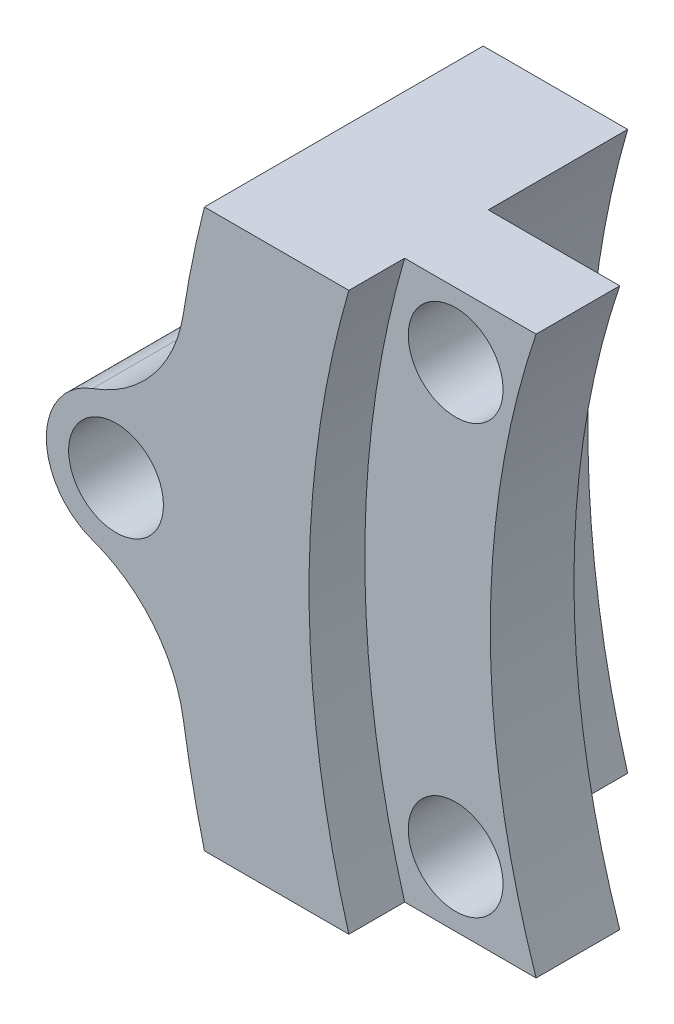
from build123d import *

# Parameters (mm, degrees)
CROQUIS1_R                       = 40.75
CROQUIS1_R_2                     = 35.75
SALIENTE_EXTRUIR1_DEPTH          = 10
CROQUIS2_R                       = 1.7
SALIENTE_EXTRUIR2_DEPTH          = 3
SALIENTE_EXTRUIR3_START          = -5
CROQUIS3_R                       = 1.7
SALIENTE_EXTRUIR3_DEPTH          = 5
CORTAR_EXTRUIR1_DEPTH            = 10
REDONDEO1_R                      = 5
TALADRO_DE_MARGEN_PARA_M51_DEPTH = 5


# Read off the part's stored shape, not the designer's step: Taladro de margen para M51
with BuildPart() as part:
    # Croquis1 → Saliente-Extruir1 (new body)
    with BuildSketch(Plane.XY):
        Circle(CROQUIS1_R)
        Circle(CROQUIS1_R_2, mode=Mode.SUBTRACT)
    extrude(amount=SALIENTE_EXTRUIR1_DEPTH)

    # Croquis2 → Saliente-Extruir2 (add)
    with BuildSketch(Plane(origin=(0, 0, 5), x_dir=(-1, 0, 0), z_dir=(0, 0, -1))):
        with BuildLine():
            Line((34.322915086, -10), (29.606798206, -10))
            ThreePointArc((29.606798206, -10), (31.25, 0), (29.606798206, 10))
            Line((29.606798206, 10), (34.322915086, 10))
            ThreePointArc((34.322915086, 10), (35.75, 0), (34.322915086, -10))
        make_face()
        with Locations((32.492418426, 7.677165354)):
            Circle(CROQUIS2_R, mode=Mode.SUBTRACT)
        with Locations(Location((32.492418426, -7.677165354, 0), (0, 0, 180))):
            Circle(CROQUIS2_R, mode=Mode.SUBTRACT)
    extrude(amount=-SALIENTE_EXTRUIR2_DEPTH)

    # Croquis3 → Saliente-Extruir3 (add)
    with BuildSketch(Plane.XY.offset(10).offset(SALIENTE_EXTRUIR3_START)):
        with BuildLine():
            Line((-40.673240589, -2.5), (-42.673240589, -2.5))
            ThreePointArc((-42.673240589, -2.5), (-45.173240589, 0), (-42.673240589, 2.5))
            Line((-42.673240589, 2.5), (-40.673240589, 2.5))
            ThreePointArc((-40.673240589, 2.5), (-40.75, 0), (-40.673240589, -2.5))
        make_face()
        with Locations((-42.673240589, 0)):
            Circle(CROQUIS3_R, mode=Mode.SUBTRACT)
    extrude(amount=SALIENTE_EXTRUIR3_DEPTH)

    # Croquis4 → Cortar-Extruir1 (cut)
    with BuildSketch(Plane.XY.offset(10)):
        Polygon((-34.322915086, -10), (-63.814245497, -10), (-63.814245497, -44.810382184), (45.541144723, -44.810382184), (45.541144723, 45.96065319), (-49.780136639, 45.96065319), (-49.780136639, 10), (-39.503955498, 10), (-24.875936239, 10), (-24.875936239, -15.19237414), align=None)
    extrude(amount=-CORTAR_EXTRUIR1_DEPTH, mode=Mode.SUBTRACT)

    # Redondeo1
    # the kernel refuses this fillet: 5 mm, written as the material it adds along each edge
    with BuildSketch(Plane(origin=(-40.673240589, -2.5, 5), x_dir=(0.10796118489430687, -0.9941551099080149, 0), z_dir=(0, 0, 1))) as redondeo1_piece_1:
        with BuildLine():
            CenterArc((4.0453205, -4.994529194), REDONDEO1_R, 92.68051287, 61.418565497)
            Line((-0.452433263, -2.810447903), (-0.902208639, -2.592039774))
            ThreePointArc((-0.902208639, -2.592039774), (-0.712999925, -1.934329627), (-0.497077555, 0.053980592))
            Line((-0.497077555, 0.053980592), (0.023383355, 0.499452919))
            ThreePointArc((0.023383355, 0.499452919), (1.905743473, 0.45541293), (3.78810359, 0.499452919))
            Line((3.78810359, 0.499452919), (3.811486945, 0))
        make_face()
    extrude(amount=5)
    with BuildSketch(Plane(origin=(-40.673240589, 2.5, 5), x_dir=(0.1079611848943066, 0.994155109908015, 0), z_dir=(0, 0, 1))) as redondeo1_piece_2:
        with BuildLine():
            CenterArc((4.0453205, 4.994529194), REDONDEO1_R, 205.900921633, 61.418565497)
            Line((-0.452433263, 2.810447903), (-0.902208639, 2.592039774))
            ThreePointArc((-0.902208639, 2.592039774), (-0.712999925, 1.934329627), (-0.497077555, -0.053980592))
            Line((-0.497077555, -0.053980592), (0.023383355, -0.499452919))
            ThreePointArc((0.023383355, -0.499452919), (1.905743473, -0.45541293), (3.78810359, -0.499452919))
            Line((3.78810359, -0.499452919), (3.811486945, 0))
        make_face()
    extrude(amount=5)

    # Taladro de margen para M51 outline → Taladro de margen para M51 (cut)
    with BuildSketch(Plane.XY):
        with BuildLine():
            ThreePointArc((-40.711057028, -1.781105183), (-40.023240589, 0), (-40.711057028, 1.781105183))
            ThreePointArc((-40.711057028, 1.781105183), (-40.75, 0), (-40.711057028, -1.781105183))
        make_face()
    extrude(amount=TALADRO_DE_MARGEN_PARA_M51_DEPTH, mode=Mode.SUBTRACT)


solid = part.part
